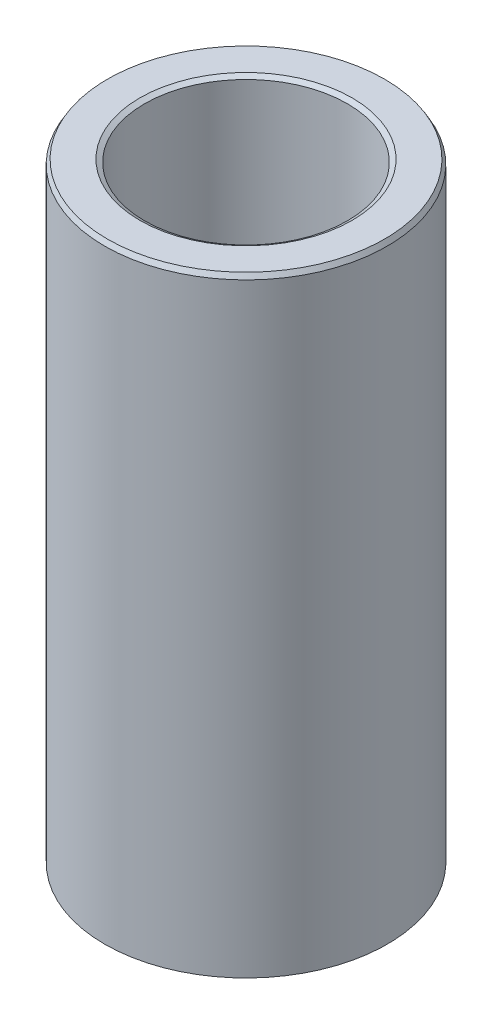
from build123d import *
from OCP.BRepFilletAPI import BRepFilletAPI_MakeChamfer

# Parameters (mm, degrees)
SKETCH1_R           = 42.5
BOSS_EXTRUDE1_DEPTH = 184.080786844
SKETCH2_R           = 30.504851604
CUT_EXTRUDE1_DEPTH  = 194.644612848
CHAMFER1_SIZE       = 1.42023672
CHAMFER1_SIZE2      = 0.819974052


with BuildPart() as part:
    # Sketch1 → Boss-Extrude1 (new body)
    with BuildSketch(Plane(origin=(0, 0, 0), x_dir=(1, 0, 0), z_dir=(0, 1, 0))):
        Circle(SKETCH1_R)
    extrude(amount=BOSS_EXTRUDE1_DEPTH)

    # Sketch2 → Cut-Extrude1 (cut, through all)
    with BuildSketch(Plane(origin=(0, 0, 0), x_dir=(1, 0, 0), z_dir=(0, 1, 0))):
        Circle(SKETCH2_R)
    extrude(amount=CUT_EXTRUDE1_DEPTH, mode=Mode.SUBTRACT)

    # Chamfer1: one chamfer whose edges measure the first distance from different faces: ONE call of the kernel's chamfer builder (chamfer() names one face for all edges)
    chamfer1_edges_1 = [part.edges().sort_by_distance(p)[0] for p in [
        (-30.504851604, 184.080786844, 0),
    ]]
    chamfer1_side_1 = [part.faces().sort_by_distance(p)[0] for p in [
        (-41.297918472, 184.080786844, 0),
    ]]
    chamfer1_edges_2 = [part.edges().sort_by_distance(p)[0] for p in [
        (-30.504851604, 0, 0),
    ]]
    chamfer1_side_2 = [part.faces().sort_by_distance(p)[0] for p in [
        (-30.504851604, 92.040393422, 0),
    ]]
    chamfer1_edges_3 = [part.edges().sort_by_distance(p)[0] for p in [
        (-42.5, 0, 0),
    ]]
    chamfer1_side_3 = [part.faces().sort_by_distance(p)[0] for p in [
        (-41.297918472, 0, 0),
    ]]
    chamfer1_edges_4 = [part.edges().sort_by_distance(p)[0] for p in [
        (-42.5, 184.080786844, 0),
    ]]
    chamfer1_side_4 = [part.faces().sort_by_distance(p)[0] for p in [
        (-42.5, 92.040393422, 0),
    ]]
    chamfer1 = BRepFilletAPI_MakeChamfer(part.part.solid().wrapped)
    for e in chamfer1_edges_1:
        chamfer1.Add(CHAMFER1_SIZE, CHAMFER1_SIZE2, e.wrapped, chamfer1_side_1[0].wrapped)  # the first distance lies on this face
    for e in chamfer1_edges_2:
        chamfer1.Add(CHAMFER1_SIZE, CHAMFER1_SIZE2, e.wrapped, chamfer1_side_2[0].wrapped)  # the first distance lies on this face
    for e in chamfer1_edges_3:
        chamfer1.Add(CHAMFER1_SIZE, CHAMFER1_SIZE2, e.wrapped, chamfer1_side_3[0].wrapped)  # the first distance lies on this face
    for e in chamfer1_edges_4:
        chamfer1.Add(CHAMFER1_SIZE, CHAMFER1_SIZE2, e.wrapped, chamfer1_side_4[0].wrapped)  # the first distance lies on this face
    add(Compound.cast(chamfer1.Shape()), mode=Mode.REPLACE)


solid = part.part
